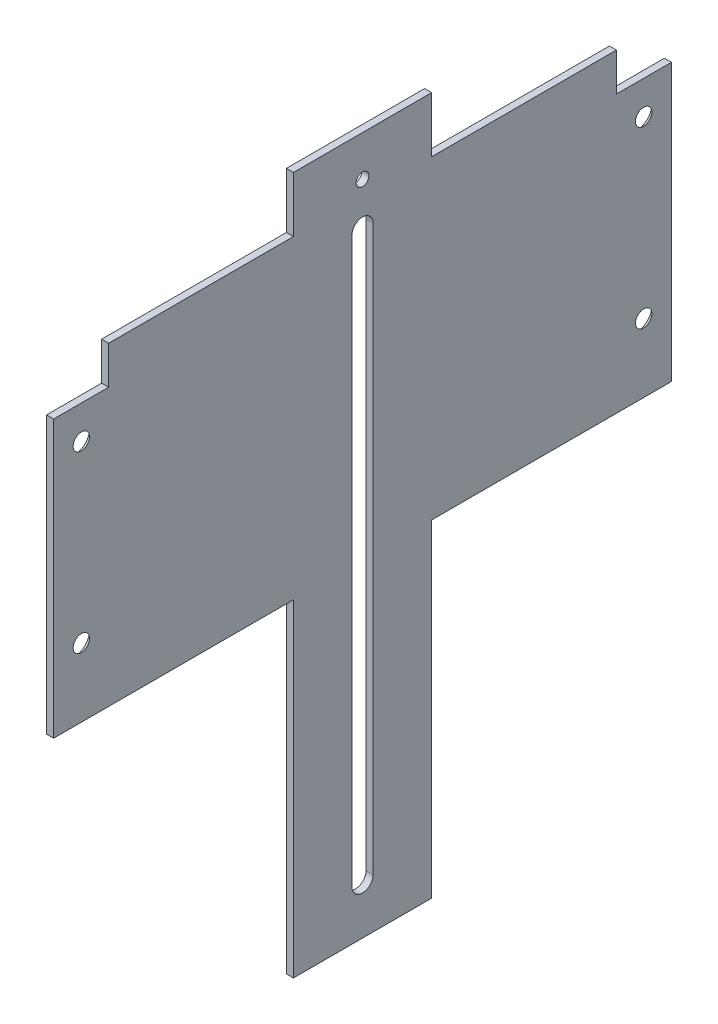
from build123d import *

# Parameters (mm, degrees)
BOSS_EXTRUDE1_DEPTH                          = 1.27
CUT_EXTRUDE2_REACH                           = 146.798
SKETCH7_W                                    = 9.906
SKETCH7_H                                    = 6.858
CUT_EXTRUDE3_REACH                           = 146.798
SKETCH18_R                                   = 1.143
CUT_EXTRUDE4_DEPTH                           = 2.54
CSK_FOR_M2_5_COUNTERSUNK_FLAT_HEAD_S_2_COUNT = 2
CSK_FOR_M2_5_COUNTERSUNK_FLAT_HEAD_S_2_PITCH = 31.442301831
CSK_FOR_M2_5_COUNTERSUNK_FLAT_HEAD_S_3_COUNT = 2
CSK_FOR_M2_5_COUNTERSUNK_FLAT_HEAD_S_3_PITCH = 101.252
CSK_FOR_M2_5_COUNTERSUNK_FLAT_HEAD_S_4_COUNT = 2
CSK_FOR_M2_5_COUNTERSUNK_FLAT_HEAD_S_4_PITCH = 106.021629154


with BuildPart() as part:
    # Sketch2 → Boss-Extrude1 (new body)
    with BuildSketch(Plane(origin=(0, 0, 0), x_dir=(0, 0, -1), z_dir=(1, 0, 0))):
        Polygon((36.346050031, -8.290645537), (-6.833949969, -8.290645537), (-6.833949969, 1.709354463), (-31.725949969, 1.709354463), (-31.725949969, -8.290645537), (-74.905949969, -8.290645537), (-74.905949969, -64.932645537), (-31.725949969, -64.932645537), (-31.725949969, -123.911447323), (-6.833949969, -123.911447323), (-6.833949969, -64.932645537), (36.346050031, -64.932645537), align=None)
    extrude(amount=BOSS_EXTRUDE1_DEPTH)

    # Sketch7 → Cut-Extrude2 (cut, up to next)
    with BuildSketch(Plane.ZY, mode=Mode.PRIVATE) as cut_extrude2_sk1:
        with Locations((-31.393050031, -11.719645537)):
            Rectangle(SKETCH7_W, SKETCH7_H)
    cut_extrude2_tool1 = extrude(cut_extrude2_sk1.sketch, amount=-CUT_EXTRUDE2_REACH, mode=Mode.PRIVATE) & part.part
    # Sketch7 → Cut-Extrude2 (cut, up to next)
    with BuildSketch(Plane.ZY, mode=Mode.PRIVATE) as cut_extrude2_sk2:
        with Locations((69.952949969, -11.719645537)):
            Rectangle(SKETCH7_W, SKETCH7_H)
    cut_extrude2_tool2 = extrude(cut_extrude2_sk2.sketch, amount=-CUT_EXTRUDE2_REACH, mode=Mode.PRIVATE) & part.part
    add(cut_extrude2_tool1.solids().sort_by_distance((0, -11.719646, -31.39305))[0], mode=Mode.SUBTRACT)
    add(cut_extrude2_tool2.solids().sort_by_distance((0, -11.719646, 69.95295))[0], mode=Mode.SUBTRACT)

    # Sketch10 → Cut-Extrude3 (cut, up to next)
    with BuildSketch(Plane.ZY, mode=Mode.PRIVATE) as cut_extrude3_sk1:
        with BuildLine():
            Line((21.184949969, -13.370645537), (21.184949969, -114.970645537))
            ThreePointArc((21.184949969, -114.970645537), (19.279949969, -116.875645537), (17.374949969, -114.970645537))
            Line((17.374949969, -114.970645537), (17.374949969, -13.370645537))
            ThreePointArc((17.374949969, -13.370645537), (19.279949969, -11.465645537), (21.184949969, -13.370645537))
        make_face()
    cut_extrude3_tool1 = extrude(cut_extrude3_sk1.sketch, amount=-CUT_EXTRUDE3_REACH, mode=Mode.PRIVATE) & part.part
    add(cut_extrude3_tool1.solids().sort_by_distance((0, -64.170646, 19.27995))[0], mode=Mode.SUBTRACT)

    # Sketch18 → Cut-Extrude4 (cut)
    with BuildSketch(Plane.ZY):
        with Locations((19.279949969, -5.591895537)):
            Circle(SKETCH18_R)
    extrude(amount=-CUT_EXTRUDE4_DEPTH, mode=Mode.SUBTRACT)

    # Sketch21 → CSK for M2.5 Countersunk Flat Head Screw1 (revolve, cut)
    with BuildSketch(Plane(origin=(0, -21.148645537, -31.346050031), x_dir=(0, 0, 1), z_dir=(0, 1, 0))):
        Polygon((0, 0), (0, 1.27), (1.45, 1.27), (1.45, 1.3), (2.75, 0), align=None)
    csk_for_m2_5_countersunk_flat_head_screw = revolve(axis=Axis((-6.35, -21.148645537, -31.346050031), (1, 0, 0)), mode=Mode.SUBTRACT)

    # CSK for M2.5 Countersunk Flat Head S 2: CSK for M2.5 Countersunk Flat Head Screw1 ×2
    with Locations(*[(0, -i * CSK_FOR_M2_5_COUNTERSUNK_FLAT_HEAD_S_2_PITCH, 0) for i in range(1, CSK_FOR_M2_5_COUNTERSUNK_FLAT_HEAD_S_2_COUNT)]):
        add(csk_for_m2_5_countersunk_flat_head_screw, mode=Mode.SUBTRACT)

    # CSK for M2.5 Countersunk Flat Head S 3: CSK for M2.5 Countersunk Flat Head Screw1 ×2
    with Locations(*[(0, 0, i * CSK_FOR_M2_5_COUNTERSUNK_FLAT_HEAD_S_3_PITCH) for i in range(1, CSK_FOR_M2_5_COUNTERSUNK_FLAT_HEAD_S_3_COUNT)]):
        add(csk_for_m2_5_countersunk_flat_head_screw, mode=Mode.SUBTRACT)

    # CSK for M2.5 Countersunk Flat Head S 4: CSK for M2.5 Countersunk Flat Head Screw1 ×2
    with Locations(*[Vector(0, -0.29656497529839515, 0.9550126781494905) * (i * CSK_FOR_M2_5_COUNTERSUNK_FLAT_HEAD_S_4_PITCH) for i in range(1, CSK_FOR_M2_5_COUNTERSUNK_FLAT_HEAD_S_4_COUNT)]):
        add(csk_for_m2_5_countersunk_flat_head_screw, mode=Mode.SUBTRACT)


solid = part.part
